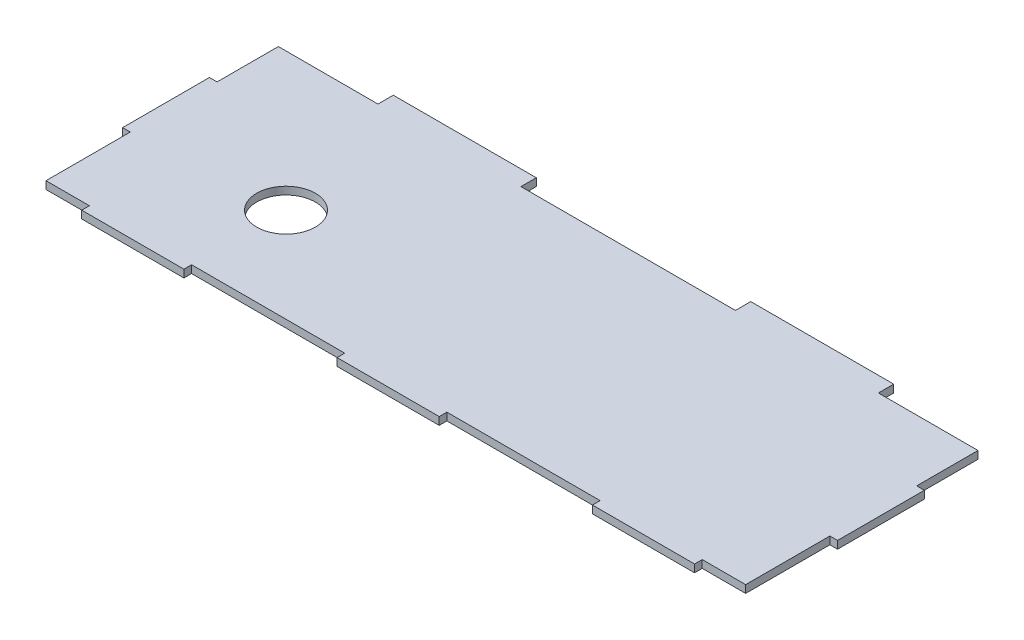
from build123d import *

# Parameters (mm, degrees)
BOSS_EXTRUDE1_DEPTH = 1.5
SKETCH3_R           = 5.75
CUT_EXTRUDE1_DEPTH  = 75.863208587
SKETCH4_W           = 1.5
SKETCH4_H           = 12
SKETCH4_W_2         = 30
SKETCH4_H_2         = 1.5
CUT_EXTRUDE2_DEPTH  = 75.863208587


with BuildPart() as part:
    # Sketch1 → Boss-Extrude1 (new body)
    with BuildSketch(Plane(origin=(0, 0, 0), x_dir=(1, 0, 0), z_dir=(0, 1, 0))):
        Polygon((-70, 23.5), (-49, 23.5), (-49, 26.5), (-21, 26.5), (-21, 23.5), (21, 23.5), (21, 26.5), (49, 26.5), (49, 23.5), (70, 23.5), (70, -23.5), (-70, -23.5), align=None)
    extrude(amount=BOSS_EXTRUDE1_DEPTH)

    # Sketch3 → Cut-Extrude1 (cut, through all)
    with BuildSketch(Plane(origin=(0, 1.5, 0), x_dir=(1, 0, 0), z_dir=(0, 1, 0))):
        with Locations((-40, -3.5)):
            Circle(SKETCH3_R)
    extrude(amount=-CUT_EXTRUDE1_DEPTH, mode=Mode.SUBTRACT)

    # Sketch4 → Cut-Extrude2 (cut, through all)
    with BuildSketch(Plane(origin=(0, 1.5, 0), x_dir=(1, 0, 0), z_dir=(0, 1, 0))):
        with Locations((-69.25, 17.5)):
            Rectangle(SKETCH4_W, SKETCH4_H)
        Polygon((-70, -5.5), (-70, -23.5), (-60, -23.5), (-60, -22), (-68.5, -22), (-68.5, -5.5), align=None)
        with Locations((-25, -22.75)):
            Rectangle(SKETCH4_W_2, SKETCH4_H_2)
        with Locations((25, -22.75)):
            Rectangle(SKETCH4_W_2, SKETCH4_H_2)
        Polygon((60, -23.5), (70, -23.5), (70, -5.5), (68.5, -5.5), (68.5, -22), (60, -22), align=None)
        with Locations((69.25, 17.5)):
            Rectangle(SKETCH4_W, SKETCH4_H)
    extrude(amount=-CUT_EXTRUDE2_DEPTH, mode=Mode.SUBTRACT)


solid = part.part
